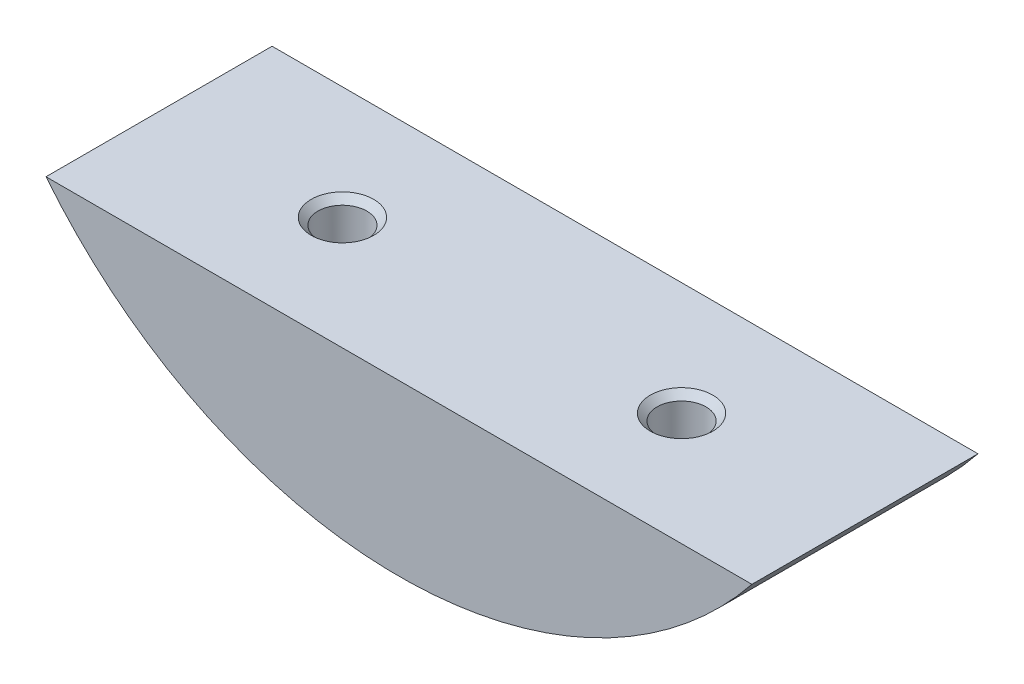
from build123d import *

# Parameters (mm, degrees)
BOSS_EXTRUDE1_DEPTH     = 25.4
CUT_EXTRUDE1_DEPTH      = 86.430512699
CUT_EXTRUDE1_DEPTH_BACK = 86.430512699
SKETCH2_R               = 2
SKETCH3_R               = 2.75
CUT_EXTRUDE2_DEPTH      = 86.430512844
CHAMFER1_SIZE           = 0.762


with BuildPart() as part:
    # Sketch1 → Boss-Extrude1 (new body)
    with BuildSketch(Plane.XY):
        with BuildLine():
            Line((0, 0), (79.31147458, 0))
            ThreePointArc((79.31147458, 0), (39.65573729, -19.05), (0, 0))
        make_face()
    extrude(amount=BOSS_EXTRUDE1_DEPTH)

    # Sketch2 → Cut-Extrude1 (cut, two sides: drawn at the far end of the back side and taken through both)
    with BuildSketch(Plane(origin=(0, 0, 0), x_dir=(1, 0, 0), z_dir=(0, 1, 0)).offset(-CUT_EXTRUDE1_DEPTH_BACK)):
        with Locations((20.60573729, -12.7)):
            Circle(SKETCH2_R)
        with Locations((58.70573729, -12.7)):
            Circle(SKETCH2_R)
    extrude(amount=CUT_EXTRUDE1_DEPTH + CUT_EXTRUDE1_DEPTH_BACK, mode=Mode.SUBTRACT)

    # Sketch3 → Cut-Extrude2 (cut, through all)
    with BuildSketch(Plane(origin=(0, 0, 0), x_dir=(1, 0, 0), z_dir=(0, 1, 0))):
        with Locations((20.60573729, -12.7)):
            Circle(SKETCH3_R)
        with Locations((58.70573729, -12.7)):
            Circle(SKETCH3_R)
    extrude(amount=-CUT_EXTRUDE2_DEPTH, mode=Mode.SUBTRACT)

    # Chamfer1
    chamfer1_edges = [part.edges().sort_by_distance(p)[0] for p in [
        (17.85573729, 0, 12.7),
        (55.95573729, 0, 12.7),
    ]]
    chamfer(chamfer1_edges, length=CHAMFER1_SIZE)


solid = part.part
